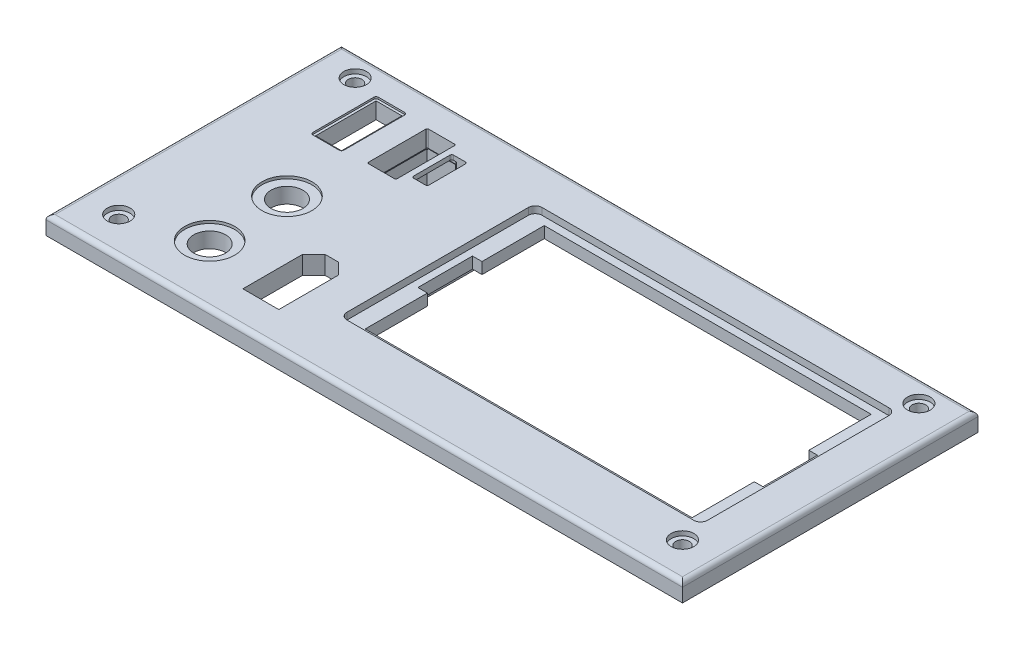
from build123d import *

# Parameters (mm, degrees)
SKETCH_1_W             = 140
SKETCH_1_H             = 65
EXTRUDE_308_DEPTH      = 4
SKETCH_2_W             = 79.3
SKETCH_2_H             = 42.9
CUT_EXTRUDE_543_DEPTH  = 1.5
FILLET_598_R           = 1.5
SKETCH_3_W             = 71.9
SKETCH_3_H             = 39.4
CUT_EXTRUDE_1215_DEPTH = 3
SKETCH_4_W             = 4.2
SKETCH_4_H             = 12
CUT_EXTRUDE_1604_DEPTH = 3
SKETCH_5_R             = 5.5
CUT_EXTRUDE_1906_DEPTH = 0.6
SKETCH_6_R             = 3.5
CUT_EXTRUDE_2046_DEPTH = 88.387413281
SKETCH_7_W             = 6.8
SKETCH_7_H             = 14.4
USB_DEPTH              = 0.4
SKETCH_8_W             = 5.7
SKETCH_8_H             = 13.3
USB_2_DEPTH            = 88.395423221
F_1_USB_R              = 0.5
XT60_DEPTH             = 88.412813706
SKETCH_10_R            = 1.5
CUT_EXTRUDE_4230_DEPTH = 88.412813706
SKETCH_13_R            = 2.5
CUT_EXTRUDE_4744_DEPTH = 1
FILLET_1_R             = 1
CUT_EXTRUDE_1_DEPTH    = 88.412813706
FILLET_2_R             = 0.4
FILLET_3_R             = 0.3
SKETCH_15_W            = 1.3
SKETCH_15_H            = 18.4
EXTRUDE_1_DEPTH        = 1
FILLET_4_R             = 0.3
FILLET_5_R             = 0.4
EXTRUDE_1_2_DEPTH      = 15
FILLET_6_R             = 0.5
SKETCH_18_W            = 1.090661214
SKETCH_18_H            = 18.346721721
CUT_EXTRUDE_2_DEPTH    = 3
CHAMFER_1_SIZE         = 0.10919107
CHAMFER_1_SIZE_2       = 0.3
CHAMFER_2_SIZE         = 0.139892297
CHAMFER_2_SIZE_2       = 0.3
CHAMFER_3_SIZE         = 0.139892297
CHAMFER_3_SIZE_2       = 0.3
CHAMFER_4_SIZE         = 0.19724319
CHAMFER_4_SIZE_2       = 0.3


with BuildPart() as part:
    # Sketch 1 → Extrude 308 (new body)
    with BuildSketch(Plane(origin=(0, 0, 0), x_dir=(1, 0, 0), z_dir=(0, 1, 0))):
        with Locations((10, -2.5)):
            Rectangle(SKETCH_1_W, SKETCH_1_H)
    extrude(amount=EXTRUDE_308_DEPTH)

    # Sketch 2 → Cut-Extrude 543 (cut)
    with BuildSketch(Plane(origin=(0, 4, 0), x_dir=(1, 0, 0), z_dir=(0, 1, 0))):
        with Locations((31.35, -0.55)):
            Rectangle(SKETCH_2_W, SKETCH_2_H)
    extrude(amount=-CUT_EXTRUDE_543_DEPTH, mode=Mode.SUBTRACT)

    # Fillet 598
    fillet_598_edges = [part.edges().sort_by_distance(p)[0] for p in [
        (-8.3, 3.25, 22),
        (-8.3, 3.25, -20.9),
        (71, 3.25, -20.9),
        (71, 3.25, 22),
    ]]
    fillet(fillet_598_edges, radius=FILLET_598_R)

    # Sketch 3 → Cut-Extrude 1215 (cut)
    with BuildSketch(Plane(origin=(0, 2.5, 0), x_dir=(1, 0, 0), z_dir=(0, 1, 0))):
        with Locations((31.35, -0.5)):
            Rectangle(SKETCH_3_W, SKETCH_3_H)
    extrude(amount=-CUT_EXTRUDE_1215_DEPTH, mode=Mode.SUBTRACT)

    # Sketch 4 → Cut-Extrude 1604 (cut)
    with BuildSketch(Plane(origin=(0, 2.5, 0), x_dir=(1, 0, 0), z_dir=(0, 1, 0))):
        with Locations((-4.6, -0.5)):
            Rectangle(SKETCH_4_W, SKETCH_4_H)
        with Locations((67.1, -0.5)):
            Rectangle(SKETCH_4_W, SKETCH_4_H)
    extrude(amount=-CUT_EXTRUDE_1604_DEPTH, mode=Mode.SUBTRACT)

    # Sketch 5 → Cut-Extrude 1906 (cut)
    with BuildSketch(Plane(origin=(0, 4, 0), x_dir=(1, 0, 0), z_dir=(0, 1, 0))):
        with Locations(Location((-37, -5, 0), (0, 0, 270))):
            Circle(SKETCH_5_R)
        with Locations(Location((-37, -22, 0), (0, 0, 270))):
            Circle(SKETCH_5_R)
    extrude(amount=-CUT_EXTRUDE_1906_DEPTH, mode=Mode.SUBTRACT)

    # Sketch 6 → Cut-Extrude 2046 (cut, through all)
    with BuildSketch(Plane(origin=(0, 3.4, 0), x_dir=(1, 0, 0), z_dir=(0, 1, 0))):
        with Locations(Location((-37, -5, 0), (0, 0, 270))):
            Circle(SKETCH_6_R)
        with Locations(Location((-37, -22, 0), (0, 0, 270))):
            Circle(SKETCH_6_R)
    extrude(amount=-CUT_EXTRUDE_2046_DEPTH, mode=Mode.SUBTRACT)

    # Sketch 7 → USB (cut)
    with BuildSketch(Plane(origin=(0, 4, 0), x_dir=(1, 0, 0), z_dir=(0, 1, 0))):
        with Locations((-42.9, 16.7)):
            Rectangle(SKETCH_7_W, SKETCH_7_H)
    extrude(amount=-USB_DEPTH, mode=Mode.SUBTRACT)

    # Sketch 8 → USB 2 (cut, through all)
    with BuildSketch(Plane(origin=(0, 3.6, 0), x_dir=(1, 0, 0), z_dir=(0, 1, 0))):
        with Locations((-42.9, 16.7)):
            Rectangle(SKETCH_8_W, SKETCH_8_H)
    extrude(amount=-USB_2_DEPTH, mode=Mode.SUBTRACT)

    # 1 USB
    f_1_usb_edges = [part.edges().sort_by_distance(p)[0] for p in [
        (-39.5, 3.8, -23.9),
        (-39.5, 3.8, -9.5),
        (-46.3, 3.8, -9.5),
        (-46.3, 3.8, -23.9),
    ]]
    fillet(f_1_usb_edges, radius=F_1_USB_R)

    # Sketch 9 → XT60 (cut, through all)
    with BuildSketch(Plane(origin=(0, 4, 0), x_dir=(1, 0, 0), z_dir=(0, 1, 0))):
        Polygon((-24.2, -27.5), (-16.3, -27.5), (-16.3, -14.4), (-18.8, -11.9), (-21.7, -11.9), (-24.2, -14.4), align=None)
    extrude(amount=-XT60_DEPTH, mode=Mode.SUBTRACT)

    # Sketch 10 → Cut-Extrude 4230 (cut, through all)
    with BuildSketch(Plane(origin=(0, 4, 0), x_dir=(1, 0, 0), z_dir=(0, 1, 0))):
        with Locations(Location((-52, 25, 0), (0, 0, 270))):
            Circle(SKETCH_10_R)
        with Locations(Location((72, 25, 0), (0, 0, 270))):
            Circle(SKETCH_10_R)
        with Locations(Location((72, -27, 0), (0, 0, 270))):
            Circle(SKETCH_10_R)
        with Locations(Location((-52, -27, 0), (0, 0, 270))):
            Circle(SKETCH_10_R)
    extrude(amount=-CUT_EXTRUDE_4230_DEPTH, mode=Mode.SUBTRACT)

    # Sketch 13 → Cut-Extrude 4744 (cut)
    with BuildSketch(Plane(origin=(0, 4, 0), x_dir=(1, 0, 0), z_dir=(0, 1, 0))):
        with Locations(Location((-52, 25, 0), (0, 0, 270))):
            Circle(SKETCH_13_R)
        with Locations(Location((72, 25, 0), (0, 0, 270))):
            Circle(SKETCH_13_R)
        with Locations(Location((72, -27, 0), (0, 0, 270))):
            Circle(SKETCH_13_R)
        with Locations(Location((-52, -27, 0), (0, 0, 270))):
            Circle(SKETCH_13_R)
    extrude(amount=-CUT_EXTRUDE_4744_DEPTH, mode=Mode.SUBTRACT)

    # Fillet 1
    fillet_1_edges = [part.edges().sort_by_distance(p)[0] for p in [
        (-60, 4, 2.5),
        (10, 4, 35),
        (80, 4, 2.5),
        (10, 4, -30),
    ]]
    fillet(fillet_1_edges, radius=FILLET_1_R)

    # Sketch 14 → Cut-Extrude 1 (cut, through all)
    with BuildSketch(Plane(origin=(0, 4, 0), x_dir=(1, 0, 0), z_dir=(0, 1, 0))):
        Polygon((-28.2, 10.15), (-34.5, 10.15), (-34.5, 23.35), (-28.2, 23.35), (-28.2, 25.9), (-26.9, 25.89999993), (-26.9, 21.14999993), (-23.5, 21.14999993), (-23.5, 12.34999993), (-26.9, 12.34999993), (-26.9, 7.59999993), (-28.2, 7.6), align=None)
    extrude(amount=-CUT_EXTRUDE_1_DEPTH, mode=Mode.SUBTRACT)

    # Fillet 2
    fillet_2_edges = [part.edges().sort_by_distance(p)[0] for p in [
        (-23.5, 2, -21.14999993),
        (-23.5, 2, -12.34999993),
    ]]
    fillet(fillet_2_edges, radius=FILLET_2_R)

    # Fillet 3
    fillet_3_edges = [part.edges().sort_by_distance(p)[0] for p in [
        (-34.5, 2, -10.15),
        (-34.5, 2, -23.35),
    ]]
    fillet(fillet_3_edges, radius=FILLET_3_R)

    # Sketch 15 → Extrude 1 (add)
    with BuildSketch(Plane(origin=(0, 4, 0), x_dir=(1, 0, 0), z_dir=(0, 1, 0))):
        with Locations((-27.55, 16.799999965)):
            Rectangle(SKETCH_15_W, SKETCH_15_H)
    extrude(amount=-EXTRUDE_1_DEPTH)

    # Fillet 4
    fillet_4_edges = [part.edges().sort_by_distance(p)[0] for p in [
        (-28.2, 3.5, -10.15),
        (-28.2, 3.5, -23.35),
    ]]
    fillet(fillet_4_edges, radius=FILLET_4_R)

    # Fillet 5
    fillet_5_edges = [part.edges().sort_by_distance(p)[0] for p in [
        (-26.9, 3.5, -21.14999993),
        (-26.9, 3.5, -12.34999993),
    ]]
    fillet(fillet_5_edges, radius=FILLET_5_R)

    # Sketch 17 → Extrude 1 2 (add)
    with BuildSketch(Plane.XZ):
        Polygon((-36.618386658, -7.996110769), (-30.309338786, -7.996110769), (-30.309338786, -5.553278209), (-23.809338786, -5.553278209), (-23.809338786, -10.1696547), (-21.309338786, -10.1696547), (-21.309338786, -23.245547993), (-23.809338786, -23.245547993), (-23.809338786, -27.954623035), (-30.309338786, -27.954623035), (-30.309338786, -25.408557701), (-36.618386658, -25.408557701), align=None)
        Polygon((-34.618386658, -9.996110769), (-28.309338786, -9.996110769), (-28.309338786, -7.553278209), (-25.809338786, -7.553278209), (-25.809338786, -12.1696547), (-23.309338786, -12.1696547), (-23.309338786, -21.245547993), (-25.809338786, -21.245547993), (-25.809338786, -25.954623035), (-28.309338786, -25.954623035), (-28.309338786, -23.408557701), (-34.618386658, -23.408557701), align=None, mode=Mode.SUBTRACT)
    extrude(amount=EXTRUDE_1_2_DEPTH)

    # Fillet 6
    fillet_6_edges = [part.edges().sort_by_distance(p)[0] for p in [
        (-36.618386658, -7.5, -7.996110769),
        (-36.618386658, -7.5, -25.408557701),
        (-30.309338786, -7.5, -25.408557701),
        (-30.309338786, -7.5, -27.954623035),
        (-23.809338786, -7.5, -27.954623035),
        (-23.809338786, -7.5, -23.245547993),
        (-21.309338786, -7.5, -23.245547993),
        (-21.309338786, -7.5, -10.1696547),
        (-23.809338786, -7.5, -10.1696547),
        (-23.809338786, -7.5, -5.553278209),
        (-30.309338786, -7.5, -5.553278209),
        (-30.309338786, -7.5, -7.996110769),
    ]]
    fillet(fillet_6_edges, radius=FILLET_6_R)

    # Sketch 18 → Cut-Extrude 2 (cut)
    with BuildSketch(Plane.XZ):
        with Locations((-26.354669393, -16.726639069)):
            Rectangle(SKETCH_18_W, SKETCH_18_H)
    extrude(amount=-CUT_EXTRUDE_2_DEPTH, mode=Mode.SUBTRACT)

    # Chamfer 1
    # the kernel refuses this chamfer: 0.3, 0.10919107 mm, written as the material it takes off along each edge
    with BuildSketch(Plane(origin=(-27.42174158, 0, -23.35), x_dir=(0, -0.09904090225205102, -0.9950833631817485), z_dir=(-1, 0, 0))) as chamfer_1_piece_1_section:
        Polygon((CHAMFER_1_SIZE * 0.995083365732, -CHAMFER_1_SIZE * 0.0990409025059), (-CHAMFER_1_SIZE_2 * 0.0990409022521, -CHAMFER_1_SIZE_2 * 0.995083363182), (0, 0), align=None)
    chamfer_1_piece_1 = extrude(amount=6.77825842, mode=Mode.PRIVATE)
    chamfer_1_piece_1 = split(chamfer_1_piece_1, bisect_by=Plane(origin=(-28.309338786, 0.039087442, -23.427423315), z_dir=(1, 0, 0)), keep=Keep.TOP, mode=Mode.PRIVATE)
    chamfer_1_piece_1 = split(chamfer_1_piece_1, bisect_by=Plane(origin=(-27.865540183, 0.039087442, -23.408557701), z_dir=(0, 0, -1)), keep=Keep.TOP, mode=Mode.PRIVATE)
    add(chamfer_1_piece_1, mode=Mode.SUBTRACT)
    with BuildSketch(Plane(origin=(-27.42174158, 0, -23.35), x_dir=(0, -0.09904090225205102, -0.9950833631817485), z_dir=(-1, 0, 0))) as chamfer_1_piece_2_section:
        Polygon((CHAMFER_1_SIZE * 0.995083365732, -CHAMFER_1_SIZE * 0.0990409025059), (-CHAMFER_1_SIZE_2 * 0.0990409022521, -CHAMFER_1_SIZE_2 * 0.995083363182), (0, 0), align=None)
    chamfer_1_piece_2 = extrude(amount=6.77825842, mode=Mode.PRIVATE)
    chamfer_1_piece_2 = split(chamfer_1_piece_2, bisect_by=Plane(origin=(-28.309338786, 0.119723223, -23.371799756), z_dir=(1, 0, 0)), keep=Keep.TOP, mode=Mode.PRIVATE)
    chamfer_1_piece_2 = split(chamfer_1_piece_2, bisect_by=Plane(origin=(-27.865540183, 0.119723223, -23.408557701), z_dir=(0, 0, 1)), keep=Keep.TOP, mode=Mode.PRIVATE)
    add(chamfer_1_piece_2, mode=Mode.SUBTRACT)
    with BuildSketch(Plane(origin=(-27.42174158, 0, -23.35), x_dir=(0, -0.09904090225205102, -0.9950833631817485), z_dir=(-1, 0, 0))) as chamfer_1_piece_3_section:
        Polygon((CHAMFER_1_SIZE * 0.995083365732, -CHAMFER_1_SIZE * 0.0990409025059), (-CHAMFER_1_SIZE_2 * 0.0990409022521, -CHAMFER_1_SIZE_2 * 0.995083363182), (0, 0), align=None)
    chamfer_1_piece_3 = extrude(amount=6.77825842, mode=Mode.PRIVATE)
    chamfer_1_piece_3 = split(chamfer_1_piece_3, bisect_by=Plane(origin=(-28.309338786, 0.119723223, -23.371799756), z_dir=(-1, 0, 0)), keep=Keep.TOP, mode=Mode.PRIVATE)
    chamfer_1_piece_3 = split(chamfer_1_piece_3, bisect_by=Plane(origin=(-31.254669393, 0.119723223, -23.408557701), z_dir=(0, 0, 1)), keep=Keep.TOP, mode=Mode.PRIVATE)
    add(chamfer_1_piece_3, mode=Mode.SUBTRACT)
    with BuildSketch(Plane(origin=(-34.2, 0, -23.05), x_dir=(0, 0, -1), z_dir=(1, 0, 0))) as chamfer_1_piece_4_section:
        Polygon((0.3 + CHAMFER_1_SIZE * 1.00000000256, 0), (0.3, CHAMFER_1_SIZE_2), (0.3, 0), align=None)
    chamfer_1_piece_4 = revolve(axis=Axis((-34.2, 0, -23.05), (0, 1, 0)), revolution_arc=90, mode=Mode.PRIVATE)
    chamfer_1_piece_4 = split(chamfer_1_piece_4, bisect_by=Plane(origin=(-34.420938944, 0.102211056, -23.408557701), z_dir=(0, 0, 1)), keep=Keep.TOP, mode=Mode.PRIVATE)
    add(chamfer_1_piece_4, mode=Mode.SUBTRACT)
    with BuildSketch(Plane(origin=(-34.5, 0, -23.05), x_dir=(-0.995083363181749, -0.09904090225204759, 0), z_dir=(0, 0, 1))) as chamfer_1_piece_5:
        Polygon((CHAMFER_1_SIZE * 0.995083365732, -CHAMFER_1_SIZE * 0.0990409025059), (-CHAMFER_1_SIZE_2 * 0.099040902252, -CHAMFER_1_SIZE_2 * 0.995083363182), (0, 0), align=None)
    extrude(amount=12.6, mode=Mode.SUBTRACT)
    with BuildSketch(Plane(origin=(-34.2, 0, -10.45), x_dir=(-1, 0, 0), z_dir=(0, 0, -1))) as chamfer_1_piece_6:
        Polygon((0.3 + CHAMFER_1_SIZE * 1.00000000256, 0), (0.3, CHAMFER_1_SIZE_2), (0.3, 0), align=None)
    revolve(axis=Axis((-34.2, 0, -10.45), (0, 1, 0)), revolution_arc=90, mode=Mode.SUBTRACT)
    with BuildSketch(Plane(origin=(-28.2, 0, -7.6), x_dir=(7.128765437782592e-10, 0.9999130865277315, -0.01318405819864573), z_dir=(0.9999999999999986, 0, 5.407110110083442e-08))) as chamfer_1_piece_7_section:
        Polygon((CHAMFER_1_SIZE_2 * 0.999913086528, CHAMFER_1_SIZE_2 * 0.0131840581986), (-CHAMFER_1_SIZE * 0.0131840582324, CHAMFER_1_SIZE * 0.999913089091), (0, 0), align=None)
    chamfer_1_piece_7 = extrude(amount=2.07825842, mode=Mode.PRIVATE)
    chamfer_1_piece_7 = split(chamfer_1_piece_7, bisect_by=Plane(origin=(-27.160871049, 0.126101095, -7.553278209), z_dir=(0, 0, -1)), keep=Keep.TOP, mode=Mode.PRIVATE)
    add(chamfer_1_piece_7, mode=Mode.SUBTRACT)
    with BuildSketch(Plane(origin=(-28.2, 0, -10.92825842), x_dir=(0.01318405819864573, 0.9999130865277315, 0), z_dir=(0, 0, 1))) as chamfer_1_piece_8:
        Polygon((CHAMFER_1_SIZE_2 * 0.999913086528, CHAMFER_1_SIZE_2 * 0.0131840581986), (-CHAMFER_1_SIZE * 0.0131840582324, CHAMFER_1_SIZE * 0.999913089091), (0, 0), align=None)
    extrude(amount=3.32825842, mode=Mode.SUBTRACT)
    with BuildSketch(Plane(origin=(-34.2, 0, -10.15), x_dir=(0, 0.9999130865277315, -0.013184058198645729), z_dir=(1, 0, 0))) as chamfer_1_piece_9:
        Polygon((CHAMFER_1_SIZE_2 * 0.999913086528, CHAMFER_1_SIZE_2 * 0.0131840581986), (-CHAMFER_1_SIZE * 0.0131840582324, CHAMFER_1_SIZE * 0.999913089091), (0, 0), align=None)
    extrude(amount=6.77825842, mode=Mode.SUBTRACT)
    with BuildSketch(Plane(origin=(-28.2, 0, -10.92825842), x_dir=(0.01318405819864573, 0.9999130865277315, 0), z_dir=(0, 0, 1))) as chamfer_1_piece_10a_section:
        Polygon((CHAMFER_1_SIZE_2 * 0.999913086528, CHAMFER_1_SIZE_2 * 0.0131840581986), (-CHAMFER_1_SIZE * 0.0131840582324, CHAMFER_1_SIZE * 0.999913089091), (0, 0), align=None)
    chamfer_1_piece_10a = extrude(amount=4.10651684, mode=Mode.PRIVATE)
    chamfer_1_piece_10a = split(chamfer_1_piece_10a, bisect_by=Plane(origin=(-28.2335768, 0.102650399, -7.600000002), z_dir=(-5.407110110083442e-08, 0, 0.9999999999999986)), keep=Keep.TOP, mode=Mode.PRIVATE)
    chamfer_1_piece_10a = split(chamfer_1_piece_10a, bisect_by=Plane(origin=(-28.233576801, 0.102650399, -7.553278209), z_dir=(0, 0, -1)), keep=Keep.TOP, mode=Mode.PRIVATE)
    with BuildSketch(Plane(origin=(-28.97825842, 0, -7.600000042), x_dir=(7.128765437782592e-10, 0.9999130865277315, -0.01318405819864573), z_dir=(0.9999999999999986, 0, 5.407110110083442e-08))) as chamfer_1_piece_10b_section:
        Polygon((CHAMFER_1_SIZE_2 * 0.999913086528, CHAMFER_1_SIZE_2 * 0.0131840581986), (-CHAMFER_1_SIZE * 0.0131840582324, CHAMFER_1_SIZE * 0.999913089091), (0, 0), align=None)
    chamfer_1_piece_10b = extrude(amount=2.85651684, mode=Mode.PRIVATE)
    chamfer_1_piece_10b = split(chamfer_1_piece_10b, bisect_by=Plane(origin=(-28.2, 0.126101061, -7.582583603), z_dir=(-1, 0, 0)), keep=Keep.TOP, mode=Mode.PRIVATE)
    chamfer_1_piece_10b = split(chamfer_1_piece_10b, bisect_by=Plane(origin=(-28.254669394, 0.126101061, -7.553278209), z_dir=(0, 0, -1)), keep=Keep.TOP, mode=Mode.PRIVATE)
    chamfer_1_piece_10b = split(chamfer_1_piece_10b, bisect_by=Plane(origin=(-28.309338786, 0.126101061, -7.582583603), z_dir=(1, 0, 0)), keep=Keep.TOP, mode=Mode.PRIVATE)
    chamfer_1_piece_10 = chamfer_1_piece_10a & chamfer_1_piece_10b
    add(chamfer_1_piece_10, mode=Mode.SUBTRACT)

    # Chamfer 2
    # the kernel refuses this chamfer: 0.3, 0.139892297 mm, written as the material it takes off along each edge
    with BuildSketch(Plane(origin=(-23.5, 0, -12.74999993), x_dir=(0.9971975577536777, -0.07481330637059844, 0), z_dir=(0, 0, -1))) as chamfer_2_piece_1:
        Polygon((CHAMFER_2_SIZE * 0.997197560936, -CHAMFER_2_SIZE * 0.0748133066094), (-CHAMFER_2_SIZE_2 * 0.0748133063706, -CHAMFER_2_SIZE_2 * 0.997197557754), (0, 0), align=None)
    extrude(amount=8, mode=Mode.SUBTRACT)
    with BuildSketch(Plane(origin=(-23.9, 0, -21.14999993), x_dir=(0, -0.07481330637059809, -0.9971975577536777), z_dir=(-1, 0, 0))) as chamfer_2_piece_2_section:
        Polygon((CHAMFER_2_SIZE * 0.997197560936, -CHAMFER_2_SIZE * 0.0748133066094), (-CHAMFER_2_SIZE_2 * 0.0748133063706, -CHAMFER_2_SIZE_2 * 0.997197557754), (0, 0), align=None)
    chamfer_2_piece_2 = extrude(amount=2.686631428, mode=Mode.PRIVATE)
    chamfer_2_piece_2 = split(chamfer_2_piece_2, bisect_by=Plane(origin=(-25.243315714, 0.111172675, -21.245547993), z_dir=(0, 0, 1)), keep=Keep.TOP, mode=Mode.PRIVATE)
    add(chamfer_2_piece_2, mode=Mode.SUBTRACT)
    with BuildSketch(Plane(origin=(-23.9, 0, -12.74999993), x_dir=(1, 0, 0), z_dir=(0, 0, -1))) as chamfer_2_piece_3:
        Polygon((0.4 + CHAMFER_2_SIZE * 1.00000000319, 0), (0.4, -CHAMFER_2_SIZE_2), (0.4, 0), align=None)
    revolve(axis=Axis((-23.9, 0, -12.74999993), (0, -1, 0)), revolution_arc=90, mode=Mode.SUBTRACT)
    with BuildSketch(Plane(origin=(-23.9, 0, -20.74999993), x_dir=(0, 0, -1), z_dir=(-1, 0, 0))) as chamfer_2_piece_4_section:
        Polygon((0.4 + CHAMFER_2_SIZE * 1.00000000319, 0), (0.4, -CHAMFER_2_SIZE_2), (0.4, 0), align=None)
    chamfer_2_piece_4 = revolve(axis=Axis((-23.9, 0, -20.74999993), (0, -1, 0)), revolution_arc=90, mode=Mode.PRIVATE)
    chamfer_2_piece_4 = split(chamfer_2_piece_4, bisect_by=Plane(origin=(-23.611122697, 0.099643861, -21.245547993), z_dir=(0, 0, 1)), keep=Keep.TOP, mode=Mode.PRIVATE)
    add(chamfer_2_piece_4, mode=Mode.SUBTRACT)
    with BuildSketch(Plane(origin=(-26.586631428, 0, -12.34999993), x_dir=(0, -0.07481330637060007, 0.9971975577536774), z_dir=(1, 0, 0))) as chamfer_2_piece_5:
        Polygon((CHAMFER_2_SIZE * 0.997197560936, -CHAMFER_2_SIZE * 0.0748133066094), (-CHAMFER_2_SIZE_2 * 0.0748133063706, -CHAMFER_2_SIZE_2 * 0.997197557754), (0, 0), align=None)
    extrude(amount=2.686631428, mode=Mode.SUBTRACT)

    # Chamfer 3
    # the kernel refuses this chamfer: 0.3, 0.139892297 mm, written as the material it takes off along each edge
    with BuildSketch(Plane(origin=(-26.9, 0, -25.89999993), x_dir=(5.391956860020527e-08, -0.07481330637059798, -0.9971975577536761), z_dir=(-0.9999999999999986, 0, -5.4071099734406077e-08))) as chamfer_3_piece_1_section:
        Polygon((CHAMFER_3_SIZE * 0.997197560936, -CHAMFER_3_SIZE * 0.0748133066094), (-CHAMFER_3_SIZE_2 * 0.0748133063706, -CHAMFER_3_SIZE_2 * 0.997197557754), (0, 0), align=None)
    chamfer_3_piece_1 = extrude(amount=1.3, mode=Mode.PRIVATE)
    chamfer_3_piece_1 = split(chamfer_3_piece_1, bisect_by=Plane(origin=(-27.549999908, 0.127454656, -25.954623035), z_dir=(0, 0, 1)), keep=Keep.TOP, mode=Mode.PRIVATE)
    add(chamfer_3_piece_1, mode=Mode.SUBTRACT)
    with BuildSketch(Plane(origin=(-28.2, 0, -25.9), x_dir=(-0.9971975577536777, -0.07481330637059809, 0), z_dir=(0, 0, 1))) as chamfer_3_piece_2_section:
        Polygon((CHAMFER_3_SIZE * 0.997197560936, -CHAMFER_3_SIZE * 0.0748133066094), (-CHAMFER_3_SIZE_2 * 0.0748133063706, -CHAMFER_3_SIZE_2 * 0.997197557754), (0, 0), align=None)
    chamfer_3_piece_2 = extrude(amount=3.218101571, mode=Mode.PRIVATE)
    chamfer_3_piece_2 = split(chamfer_3_piece_2, bisect_by=Plane(origin=(-28.309338786, 0.10709581, -24.290949216), z_dir=(1, 0, 0)), keep=Keep.TOP, mode=Mode.PRIVATE)
    add(chamfer_3_piece_2, mode=Mode.SUBTRACT)
    with BuildSketch(Plane(origin=(-26.9, 0, -25.89999993), x_dir=(0, -0.0748133063705981, -0.9971975577536777), z_dir=(1, 0, 0))) as chamfer_3_piece_3_section:
        Polygon((CHAMFER_3_SIZE * 0.997197560936, CHAMFER_3_SIZE * 0.0748133066094), (-CHAMFER_3_SIZE_2 * 0.0748133063706, CHAMFER_3_SIZE_2 * 0.997197557754), (0, 0), align=None)
    chamfer_3_piece_3 = extrude(amount=1.090661214, mode=Mode.PRIVATE)
    chamfer_3_piece_3 = split(chamfer_3_piece_3, bisect_by=Plane(origin=(-26.354669393, 0.12745464, -25.954623035), z_dir=(0, 0, 1)), keep=Keep.TOP, mode=Mode.PRIVATE)
    add(chamfer_3_piece_3, mode=Mode.SUBTRACT)
    with BuildSketch(Plane(origin=(-28.2, 0, -26.677292641), x_dir=(-0.9971975577536777, -0.07481330637059809, 0), z_dir=(0, 0, 1))) as chamfer_3_piece_4a_section:
        Polygon((CHAMFER_3_SIZE * 0.997197560936, -CHAMFER_3_SIZE * 0.0748133066094), (-CHAMFER_3_SIZE_2 * 0.0748133063706, -CHAMFER_3_SIZE_2 * 0.997197557754), (0, 0), align=None)
    chamfer_3_piece_4a = extrude(amount=3.995394213, mode=Mode.PRIVATE)
    chamfer_3_piece_4a = split(chamfer_3_piece_4a, bisect_by=Plane(origin=(-28.309338786, 0.107095811, -25.927311518), z_dir=(1, 0, 0)), keep=Keep.TOP, mode=Mode.PRIVATE)
    chamfer_3_piece_4a = split(chamfer_3_piece_4a, bisect_by=Plane(origin=(-28.239160304, 0.107095811, -25.954623035), z_dir=(0, 0, 1)), keep=Keep.TOP, mode=Mode.PRIVATE)
    chamfer_3_piece_4a = split(chamfer_3_piece_4a, bisect_by=Plane(origin=(-28.239160305, 0.107095811, -25.900000002), z_dir=(5.4071099734406077e-08, 0, -0.9999999999999986)), keep=Keep.TOP, mode=Mode.PRIVATE)
    with BuildSketch(Plane(origin=(-26.9, 0, -25.89999993), x_dir=(5.391956860020527e-08, -0.07481330637059798, -0.9971975577536761), z_dir=(-0.9999999999999986, 0, -5.4071099734406077e-08))) as chamfer_3_piece_4b_section:
        Polygon((CHAMFER_3_SIZE * 0.997197560936, -CHAMFER_3_SIZE * 0.0748133066094), (-CHAMFER_3_SIZE_2 * 0.0748133063706, -CHAMFER_3_SIZE_2 * 0.997197557754), (0, 0), align=None)
    chamfer_3_piece_4b = extrude(amount=2.077292641, mode=Mode.PRIVATE)
    chamfer_3_piece_4b = split(chamfer_3_piece_4b, bisect_by=Plane(origin=(-28.309338786, 0.127454674, -25.921218312), z_dir=(1, 0, 0)), keep=Keep.TOP, mode=Mode.PRIVATE)
    chamfer_3_piece_4b = split(chamfer_3_piece_4b, bisect_by=Plane(origin=(-28.254669393, 0.127454674, -25.954623035), z_dir=(0, 0, 1)), keep=Keep.TOP, mode=Mode.PRIVATE)
    chamfer_3_piece_4b = split(chamfer_3_piece_4b, bisect_by=Plane(origin=(-28.2, 0.127454674, -25.921218312), z_dir=(-1, 0, 0)), keep=Keep.TOP, mode=Mode.PRIVATE)
    chamfer_3_piece_4 = chamfer_3_piece_4a & chamfer_3_piece_4b
    add(chamfer_3_piece_4, mode=Mode.SUBTRACT)

    # Chamfer 4
    # the kernel refuses this chamfer: 0.3, 0.19724319 mm, written as the material it takes off along each edge
    with BuildSketch(Plane(origin=(-26.586631428, 0, -12.210107632), x_dir=(0, -0.037338849671240314, 0.9993026620124799), z_dir=(1, 0, 0))) as chamfer_4_piece_1_section:
        Polygon((CHAMFER_4_SIZE * 0.999302661185, -CHAMFER_4_SIZE * 0.0373388496403), (-CHAMFER_4_SIZE_2 * 0.456164044188, -CHAMFER_4_SIZE_2 * 0.889895704445), (0, 0), align=None)
    chamfer_4_piece_1 = extrude(amount=2.686631428, mode=Mode.PRIVATE)
    chamfer_4_piece_1 = split(chamfer_4_piece_1, bisect_by=Plane(origin=(-24.854669393, 0.11986898, -12.1696547), z_dir=(0, 0, -1)), keep=Keep.TOP, mode=Mode.PRIVATE)
    add(chamfer_4_piece_1, mode=Mode.SUBTRACT)
    with BuildSketch(Plane(origin=(-23.9, 0, -12.74999993), x_dir=(1, 0, 0), z_dir=(0, 0, -1))) as chamfer_4_piece_2_section:
        Polygon((0.539892297 + CHAMFER_4_SIZE, 0), (0.539892297 - CHAMFER_4_SIZE_2 * 0.42261826174, -CHAMFER_4_SIZE_2 * 0.906307787037), (0.539892297, 0), align=None)
    chamfer_4_piece_2 = revolve(axis=Axis((-23.9, 0, -12.74999993), (0, -1, 0)), revolution_arc=90, mode=Mode.PRIVATE)
    chamfer_4_piece_2 = split(chamfer_4_piece_2, bisect_by=Plane(origin=(-23.367994625, 0.092492126, -12.1696547), z_dir=(0, 0, -1)), keep=Keep.TOP, mode=Mode.PRIVATE)
    chamfer_4_piece_2 = split(chamfer_4_piece_2, bisect_by=Plane(origin=(-23.309338786, 0.092492126, -12.589424618), z_dir=(-1, 0, 0)), keep=Keep.TOP, mode=Mode.PRIVATE)
    add(chamfer_4_piece_2, mode=Mode.SUBTRACT)
    with BuildSketch(Plane(origin=(-23.360107703, 0, -12.74999993), x_dir=(0.9993026620124882, -0.037338849671018054, 0), z_dir=(0, 0, -1))) as chamfer_4_piece_3_section:
        Polygon((CHAMFER_4_SIZE * 0.999302661185, -CHAMFER_4_SIZE * 0.0373388496403), (-CHAMFER_4_SIZE_2 * 0.456164044188, -CHAMFER_4_SIZE_2 * 0.889895704445), (0, 0), align=None)
    chamfer_4_piece_3 = extrude(amount=8, mode=Mode.PRIVATE)
    chamfer_4_piece_3 = split(chamfer_4_piece_3, bisect_by=Plane(origin=(-23.309338786, 0.115725916, -16.74999993), z_dir=(-1, 0, 0)), keep=Keep.TOP, mode=Mode.PRIVATE)
    add(chamfer_4_piece_3, mode=Mode.SUBTRACT)
    with BuildSketch(Plane(origin=(-23.9, 0, -20.74999993), x_dir=(-0.8582781136114358, 0, -0.5131848396977401), z_dir=(-0.5131848396977401, 0, 0.8582781136114358))) as chamfer_4_piece_4_section:
        Polygon((0.539892297 + CHAMFER_4_SIZE, 0), (0.539892297 - CHAMFER_4_SIZE_2 * 0.42261826174, -CHAMFER_4_SIZE_2 * 0.906307787037), (0.539892297, 0), align=None)
    chamfer_4_piece_4 = revolve(axis=Axis((-23.9, 0, -20.74999993), (0, -1, 0)), revolution_arc=149.123795854, mode=Mode.PRIVATE)
    chamfer_4_piece_4 = split(chamfer_4_piece_4, bisect_by=Plane(origin=(-23.522005421, 0.154483329, -21.217855468), z_dir=(0, -0.4226182617400758, 0.9063077870369408)), keep=Keep.TOP, mode=Mode.PRIVATE)
    chamfer_4_piece_4 = split(chamfer_4_piece_4, bisect_by=Plane(origin=(-23.309338786, 0.104017647, -21.109631464), z_dir=(-1, 0, 0)), keep=Keep.TOP, mode=Mode.PRIVATE)
    chamfer_4_piece_4 = split(chamfer_4_piece_4, bisect_by=Plane(origin=(-23.522005421, 0.104017647, -21.245547993), z_dir=(0, 0, 1)), keep=Keep.TOP, mode=Mode.PRIVATE)
    add(chamfer_4_piece_4, mode=Mode.SUBTRACT)


solid = part.part
